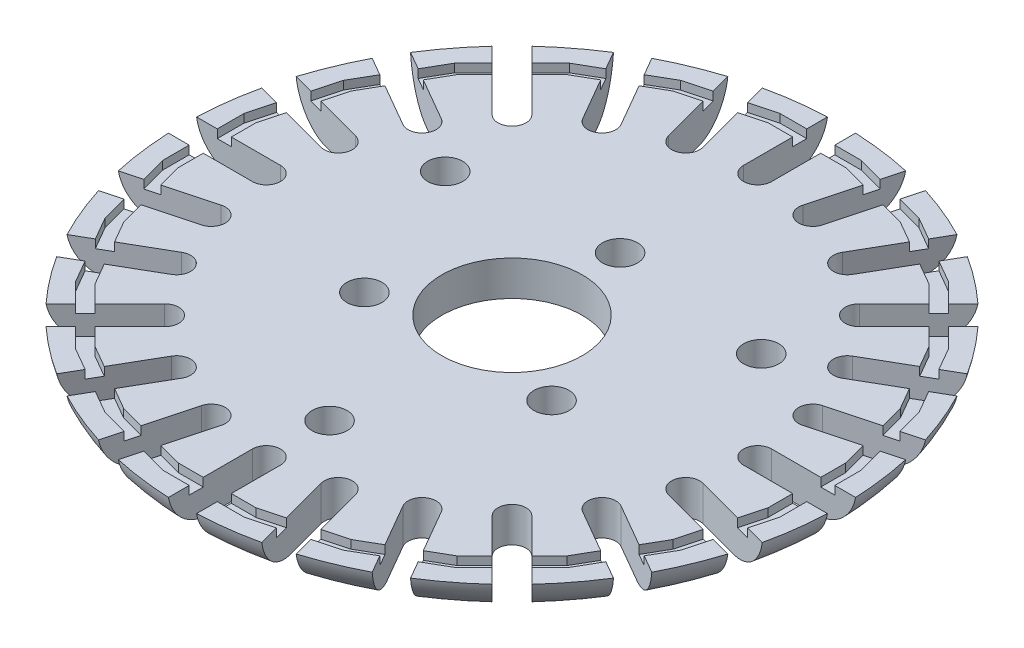
from build123d import *

# Parameters (mm, degrees)
ESBO_O1_R                = 23.5
RESSALTO_EXTRUS_O1_DEPTH = 2.5
FILETE1_R                = 3
CORTE_EXTRUS_O1_DEPTH    = 34.327916234
PADR_OCIRCULAR1_COUNT    = 24
CORTE_EXTRUS_O2_DEPTH    = 0.6
PADR_OCIRCULAR2_COUNT    = 24
ESBO_O5_R                = 5
CORTE_EXTRUS_O3_DEPTH    = 34.29789798
ESBO_O6_R                = 1.25
CORTE_EXTRUS_O5_DEPTH    = 2.5


with BuildPart() as part:
    # Esboço1 → Ressalto-extrusão1 (new body)
    with BuildSketch(Plane(origin=(0, 0, 0), x_dir=(1, 0, 0), z_dir=(0, 1, 0))):
        with Locations(Location((0, 0, 0), (0, 0, 270))):
            Circle(ESBO_O1_R)
    extrude(amount=RESSALTO_EXTRUS_O1_DEPTH)

    # Filete1
    # the kernel refuses this fillet: 3 mm, written as the material it takes off along each edge
    with BuildSketch(Plane(origin=(0, 0, 0), x_dir=(0, 0, 1), z_dir=(-1, 0, 0))) as filete1_piece_1:
        with BuildLine():
            CenterArc((20.541960108, 3), FILETE1_R, 270, 80.405931773)
            Line((20.541960108, 0), (20.541960108, -0.06))
            Line((20.541960108, -0.06), (23.5, -0.06))
            Line((23.5, -0.06), (23.56, 0))
            ThreePointArc((23.56, 0), (23.56, 1.25), (23.559160798, 2.49))
            Line((23.559160798, 2.49), (23.5, 2.5))
        make_face()
    revolve(axis=Axis((0, 0, 0), (0, 1, 0)), mode=Mode.SUBTRACT)

    # Esboço2 → Corte-extrusão1 (cut, through all)
    with BuildSketch(Plane(origin=(0, 2.5, 0), x_dir=(1, 0, 0), z_dir=(0, 1, 0))):
        with BuildLine():
            Line((1, 17.5), (1, 23.5))
            Line((1, 23.5), (-1, 23.5))
            Line((-1, 23.5), (-1, 17.5))
            ThreePointArc((-1, 17.5), (0, 16.5), (1, 17.5))
        make_face()
    corte_extrus_o1 = extrude(amount=-CORTE_EXTRUS_O1_DEPTH, mode=Mode.SUBTRACT)

    # PadrãoCircular1: Corte-extrusão1 ×24 about axis
    padr_ocircular1_axis = Axis((0, 0, 0), (0, 1, 0))
    for i in range(1, PADR_OCIRCULAR1_COUNT):
        add(corte_extrus_o1.rotate(padr_ocircular1_axis, i * 360 / PADR_OCIRCULAR1_COUNT), mode=Mode.SUBTRACT)

    # Esboço4 → Corte-extrusão2 (cut)
    with BuildSketch(Plane(origin=(0, 2.5, 0), x_dir=(1, 0, 0), z_dir=(0, 1, 0))):
        Polygon((-2.896354947, 22), (2.896354947, 22), (2.764702449, 21), (-2.764702449, 21), align=None)
    corte_extrus_o2 = extrude(amount=-CORTE_EXTRUS_O2_DEPTH, mode=Mode.SUBTRACT)

    # PadrãoCircular2: Corte-extrusão2 ×24 about axis
    padr_ocircular2_axis = Axis((0, 0, 0), (0, 1, 0))
    for i in range(1, PADR_OCIRCULAR2_COUNT):
        add(corte_extrus_o2.rotate(padr_ocircular2_axis, i * 360 / PADR_OCIRCULAR2_COUNT), mode=Mode.SUBTRACT)

    # Esboço5 → Corte-extrusão3 (cut, through all)
    with BuildSketch(Plane(origin=(0, 2.5, 0), x_dir=(1, 0, 0), z_dir=(0, 1, 0))):
        with Locations(Location((0, 0, 0), (0, 0, 270))):
            Circle(ESBO_O5_R)
    extrude(amount=-CORTE_EXTRUS_O3_DEPTH, mode=Mode.SUBTRACT)

    # Esboço6 → Corte-extrusão5 (cut)
    with BuildSketch(Plane(origin=(0, 2.5, 0), x_dir=(1, 0, 0), z_dir=(0, 1, 0))):
        with Locations(Location((0, 7.7, 0), (0, 0, 270))):
            Circle(ESBO_O6_R)
        with Locations(Location((-6.668395609, -3.85, 0), (0, 0, 270))):
            Circle(ESBO_O6_R)
        with Locations(Location((6.668395609, -3.85, 0), (0, 0, 270))):
            Circle(ESBO_O6_R)
        with Locations(Location((-11.258330249, 6.5, 0), (0, 0, 270))):
            Circle(ESBO_O6_R)
        with Locations(Location((11.258330249, 6.5, 0), (0, 0, 270))):
            Circle(ESBO_O6_R)
        with Locations(Location((0, -13, 0), (0, 0, 270))):
            Circle(ESBO_O6_R)
    extrude(amount=-CORTE_EXTRUS_O5_DEPTH, mode=Mode.SUBTRACT)


solid = part.part
